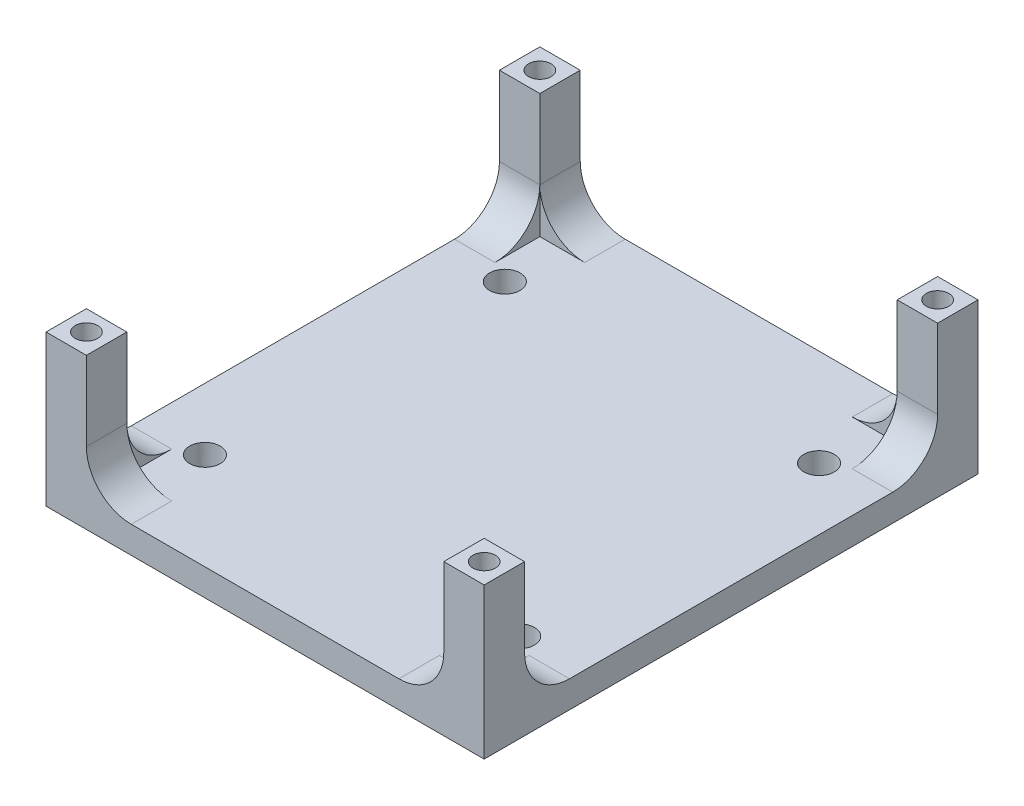
from build123d import *

# Parameters (mm, degrees)
SKETCH1_W               = 48.8
SKETCH1_H               = 55
BOSS_EXTRUDE1_DEPTH     = 3
SKETCH2_W               = 4.5
SKETCH2_H               = 4.5
BOSS_EXTRUDE2_DEPTH     = 13.8
FILLET1_R               = 5
FILLET2_START           = -27.5
FILLET2_DEPTH           = 4.5
MIRROR4_COPY_1_SKETCH_W = 4.5
MIRROR4_COPY_1_SKETCH_H = 4.5
MIRROR4_COPY_1_DEPTH    = 13.8
FILLET3_R               = 5
FILLET4_START           = -27.5
FILLET4_DEPTH           = 4.5
FILLET5_R               = 5
FILLET6_START           = 23
FILLET6_DEPTH           = 4.5
FILLET7_R               = 5
FILLET8_START           = 23
FILLET8_DEPTH           = 4.5


with BuildPart() as part:
    # Sketch1 → Boss-Extrude1 (new body)
    with BuildSketch(Plane(origin=(0, 0, 0), x_dir=(1, 0, 0), z_dir=(0, 1, 0))):
        Rectangle(SKETCH1_W, SKETCH1_H)
    extrude(amount=BOSS_EXTRUDE1_DEPTH)

    # Sketch2 → Boss-Extrude2 (add)
    with BuildSketch(Plane(origin=(0, 3, 0), x_dir=(1, 0, 0), z_dir=(0, 1, 0))):
        with Locations((-22.15, 25.25)):
            Rectangle(SKETCH2_W, SKETCH2_H)
    boss_extrude2 = extrude(amount=BOSS_EXTRUDE2_DEPTH)

    # Sketch11 → M3x0.5 Tapped Hole1 (revolve, cut)
    with BuildSketch(Plane(origin=(-22.15, 16.8, -25.25), x_dir=(0, 0, 1), z_dir=(1, 0, 0))):
        Polygon((0, 0), (0, 7.751075774), (1.25, 7), (1.25, 0), align=None)
    m3x0_5_tapped_hole1 = revolve(axis=Axis((-22.15, 23.15, -25.25), (0, -1, 0)), mode=Mode.SUBTRACT)

    # Sketch13 → M3 Clearance Hole1 (revolve, cut)
    with BuildSketch(Plane(origin=(-17.5, 3, -16.7), x_dir=(0, 0, 1), z_dir=(1, 0, 0))):
        Polygon((0, 0), (0, 9.521463052), (1.7, 8.5), (1.7, 0), align=None)
    m3_clearance_hole1 = revolve(axis=Axis((-17.5, 9.35, -16.7), (0, -1, 0)), mode=Mode.SUBTRACT)

    # Fillet1
    fillet1_edges = [part.edges().sort_by_distance(p)[0] for p in [
        (-22.15, 3, -23),
    ]]
    fillet(fillet1_edges, radius=FILLET1_R)

    # Fillet2: read off the stored shape, not the designer's step
    # Fillet2 outline → Fillet2 (add)
    with BuildSketch(Plane.XY.offset(FILLET2_START)):
        with BuildLine():
            ThreePointArc((-14.9, 3), (-18.435533906, 4.464466094), (-19.9, 8))
            Line((-19.9, 8), (-19.9, 3))
            Line((-19.9, 3), (-14.9, 3))
        make_face()
    extrude(amount=FILLET2_DEPTH)

    # Mirror3: Boss-Extrude2, M3x0.5 Tapped Hole1, M3 Clearance Hole1 across plane
    add(boss_extrude2.mirror(Plane(origin=(0, 0, 0), x_dir=(0, 0, 1), z_dir=(1, 0, 0))))
    add(m3x0_5_tapped_hole1.mirror(Plane(origin=(0, 0, 0), x_dir=(0, 0, 1), z_dir=(1, 0, 0))), mode=Mode.SUBTRACT)
    add(m3_clearance_hole1.mirror(Plane(origin=(0, 0, 0), x_dir=(0, 0, 1), z_dir=(1, 0, 0))), mode=Mode.SUBTRACT)

    # Mirror4: Boss-Extrude2, M3x0.5 Tapped Hole1, M3 Clearance Hole1 across plane
    add(boss_extrude2.mirror(Plane.XY))
    add(m3x0_5_tapped_hole1.mirror(Plane.XY), mode=Mode.SUBTRACT)
    add(m3_clearance_hole1.mirror(Plane.XY), mode=Mode.SUBTRACT)

    # Mirror4 copy 1 sketch → Mirror4 copy 1 (add)
    with BuildSketch(Plane(origin=(0, 3, 0), x_dir=(-1, 0, 0), z_dir=(0, 1, 0))):
        with Locations((-22.15, 25.25)):
            Rectangle(MIRROR4_COPY_1_SKETCH_W, MIRROR4_COPY_1_SKETCH_H)
    extrude(amount=MIRROR4_COPY_1_DEPTH)

    # Mirror4 copy 2 sketch → Mirror4 copy 2 (revolve, cut)
    with BuildSketch(Plane(origin=(22.15, 16.8, 25.25), x_dir=(0, 0, -1), z_dir=(-1, 0, 0))):
        Polygon((0, 0), (0, 7.751075774), (1.25, 7), (1.25, 0), align=None)
    revolve(axis=Axis((22.15, 23.15, 25.25), (0, -1, 0)), mode=Mode.SUBTRACT)

    # Mirror4 copy 3 sketch → Mirror4 copy 3 (revolve, cut)
    with BuildSketch(Plane(origin=(17.5, 3, 16.7), x_dir=(0, 0, -1), z_dir=(-1, 0, 0))):
        Polygon((0, 0), (0, 9.521463052), (1.7, 8.5), (1.7, 0), align=None)
    revolve(axis=Axis((17.5, 9.35, 16.7), (0, -1, 0)), mode=Mode.SUBTRACT)

    # Fillet3
    fillet3_edges = [part.edges().sort_by_distance(p)[0] for p in [
        (22.15, 3, -23),
    ]]
    fillet(fillet3_edges, radius=FILLET3_R)

    # Fillet4: read off the stored shape, not the designer's step
    # Fillet4 outline → Fillet4 (add)
    with BuildSketch(Plane.XY.offset(FILLET4_START)):
        with BuildLine():
            Line((19.9, 3), (19.9, 8))
            ThreePointArc((19.9, 8), (18.435533906, 4.464466094), (14.9, 3))
            Line((14.9, 3), (19.9, 3))
        make_face()
    extrude(amount=FILLET4_DEPTH)

    # Fillet5
    fillet5_edges = [part.edges().sort_by_distance(p)[0] for p in [
        (22.15, 3, 23),
    ]]
    fillet(fillet5_edges, radius=FILLET5_R)

    # Fillet6: read off the stored shape, not the designer's step
    # Fillet6 outline → Fillet6 (add)
    with BuildSketch(Plane.XY.offset(FILLET6_START)):
        with BuildLine():
            Line((19.9, 3), (19.9, 8))
            ThreePointArc((19.9, 8), (18.435533906, 4.464466094), (14.9, 3))
            Line((14.9, 3), (19.9, 3))
        make_face()
    extrude(amount=FILLET6_DEPTH)

    # Fillet7
    fillet7_edges = [part.edges().sort_by_distance(p)[0] for p in [
        (-22.15, 3, 23),
    ]]
    fillet(fillet7_edges, radius=FILLET7_R)

    # Fillet8: read off the stored shape, not the designer's step
    # Fillet8 outline → Fillet8 (add)
    with BuildSketch(Plane.XY.offset(FILLET8_START)):
        with BuildLine():
            ThreePointArc((-14.9, 3), (-18.435533906, 4.464466094), (-19.9, 8))
            Line((-19.9, 8), (-19.9, 3))
            Line((-19.9, 3), (-14.9, 3))
        make_face()
    extrude(amount=FILLET8_DEPTH)


solid = part.part
